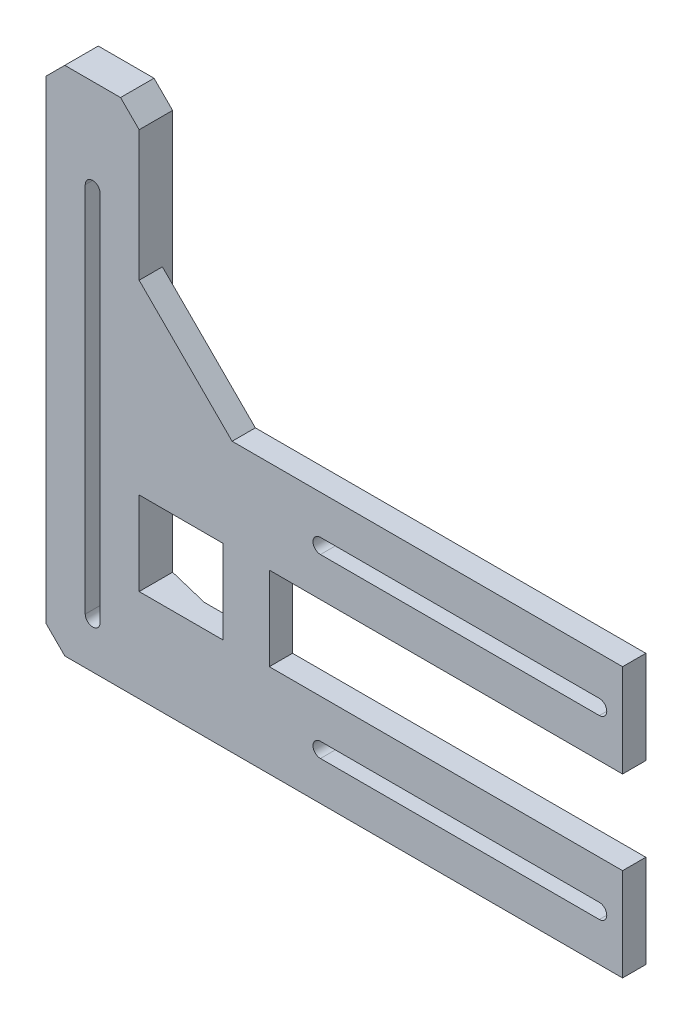
from build123d import *

# Parameters (mm, degrees)
SKETCH_1_W                  = 76
SKETCH_1_H                  = 20
SKETCH_1_W_2                = 18
SKETCH_1_W_3                = 10
SKETCH_1_H_2                = 18
SKETCH_1_W_4                = 20
SKETCH_1_H_3                = 52.041621827
EXTRUDE_1_DEPTH             = 5
HOLE_WIZARD_3_2_3_2_1_DEPTH = 5
SKETCH_8_W                  = 20
SKETCH_8_H                  = 110.041621827
EXTRUDE_2_DEPTH             = 2.2
HOLE_START                  = -2.2
HOLE_WIZARD_3_2_3_2_3_DEPTH = 7.2
RIB_1_REACH                 = 147.55
SKETCH_11_WALL_W            = 302.364540162
SKETCH_11_WALL_H            = 20
RIB_2_REACH                 = 113.533
SKETCH_12_WALL_W            = 234.330707354
SKETCH_12_WALL_H            = 20
RIB_3_REACH                 = 122.99
SKETCH_13_WALL_W            = 272.265137078
SKETCH_13_WALL_H            = 5
CHAMFER_1_SIZE              = 4


# Read off the part's stored shape, not the designer's step: Ø3.2 (3.2) 直径槽口1, Ø3.2 (3.2) 直径槽口3
with BuildPart() as part:
    # 草图1 → 凸台-拉伸1 (new body)
    with BuildSketch(Plane.XY):
        with Locations((-9.134530028, -25.635533007)):
            Rectangle(SKETCH_1_W, SKETCH_1_H)
        with Locations((-66.134530028, -25.635533007)):
            Rectangle(SKETCH_1_W_2, SKETCH_1_H)
        with Locations((-52.134530028, -25.635533007)):
            Rectangle(SKETCH_1_W_3, SKETCH_1_H)
        with Locations((-66.134530028, 12.364466993)):
            Rectangle(SKETCH_1_W_2, SKETCH_1_H)
        with Locations((-9.134530028, 12.364466993)):
            Rectangle(SKETCH_1_W, SKETCH_1_H)
        with Locations((-52.134530028, 12.364466993)):
            Rectangle(SKETCH_1_W_3, SKETCH_1_H)
        with Locations((-52.134530028, -6.635533007)):
            Rectangle(SKETCH_1_W_3, SKETCH_1_H_2)
        with Locations((-85.134530028, 12.364466993)):
            Rectangle(SKETCH_1_W_4, SKETCH_1_H)
        with Locations((-85.134530028, -6.635533007)):
            Rectangle(SKETCH_1_W_4, SKETCH_1_H_2)
        with Locations((-85.134530028, -25.635533007)):
            Rectangle(SKETCH_1_W_4, SKETCH_1_H)
        with Locations((-85.134530028, 48.385277907)):
            Rectangle(SKETCH_1_W_4, SKETCH_1_H_3)
    extrude(amount=EXTRUDE_1_DEPTH)

    # Ø3.2 (3.2) 直径槽口1 outline → Ø3.2 (3.2) 直径槽口1 (cut)
    with BuildSketch(Plane.XY):
        with BuildLine():
            Line((-36.134530028, 10.764466993), (23.865469972, 10.764466993))
            ThreePointArc((23.865469972, 10.764466993), (25.465469972, 12.364466993), (23.865469972, 13.964466993))
            Line((23.865469972, 13.964466993), (-36.134530028, 13.964466993))
            ThreePointArc((-36.134530028, 13.964466993), (-37.734530028, 12.364466993), (-36.134530028, 10.764466993))
        make_face()
        with BuildLine():
            Line((-36.134530028, -27.235533007), (23.865469972, -27.235533007))
            ThreePointArc((23.865469972, -27.235533007), (25.465469972, -25.635533007), (23.865469972, -24.035533007))
            Line((23.865469972, -24.035533007), (-36.134530028, -24.035533007))
            ThreePointArc((-36.134530028, -24.035533007), (-37.734530028, -25.635533007), (-36.134530028, -27.235533007))
        make_face()
    extrude(amount=HOLE_WIZARD_3_2_3_2_1_DEPTH, mode=Mode.SUBTRACT)

    # 草图8 → 凸台-拉伸2 (add)
    with BuildSketch(Plane(origin=(0, 0, 0), x_dir=(-1, 0, 0), z_dir=(0, 0, -1))):
        with Locations((85.134530028, 19.385277907)):
            Rectangle(SKETCH_8_W, SKETCH_8_H)
    extrude(amount=EXTRUDE_2_DEPTH)

    # Ø3.2 (3.2) 直径槽口3 outline → Ø3.2 (3.2) 直径槽口3 (cut)
    with BuildSketch(Plane.XY.offset(HOLE_START)):
        with BuildLine():
            Line((-83.534530028, -25.635533007), (-83.534530028, 54.364466993))
            ThreePointArc((-83.534530028, 54.364466993), (-85.134530028, 55.964466993), (-86.734530028, 54.364466993))
            Line((-86.734530028, 54.364466993), (-86.734530028, -25.635533007))
            ThreePointArc((-86.734530028, -25.635533007), (-85.134530028, -27.235533007), (-83.534530028, -25.635533007))
        make_face()
    extrude(amount=HOLE_WIZARD_3_2_3_2_3_DEPTH, mode=Mode.SUBTRACT)

    # 草图11 wall → 筋1 (add, up to next)
    with BuildSketch(Plane(origin=(-70.634530028, -35.635533007, -1.1), x_dir=(0.971399006497, 0, 0.237453090477), z_dir=(-0.237453090477, 0, 0.971399006497)), mode=Mode.PRIVATE) as rib_1_sk1:
        with Locations((0, 10)):
            Rectangle(SKETCH_11_WALL_W, SKETCH_11_WALL_H)
    rib_1_tool1 = extrude(rib_1_sk1.sketch, amount=RIB_1_REACH, mode=Mode.PRIVATE) - part.part
    add(rib_1_tool1.solids().sort_by_distance((-70.634530028, -35.635533007, -1.1))[0])

    # 草图12 wall → 筋2 (add, up to next)
    with BuildSketch(Plane(origin=(-70.634530028, 22.364466993, -1.1), x_dir=(0.971399006497, 0, 0.237453090477), z_dir=(0.237453090477, 0, -0.971399006497)), mode=Mode.PRIVATE) as rib_2_sk1:
        with Locations((0, 10)):
            Rectangle(SKETCH_12_WALL_W, SKETCH_12_WALL_H)
    rib_2_tool1 = extrude(rib_2_sk1.sketch, amount=-RIB_2_REACH, mode=Mode.PRIVATE) - part.part
    add(rib_2_tool1.solids().sort_by_distance((-70.634530028, 22.364466993, -1.1))[0])

    # 草图13 wall → 筋3 (add, up to next)
    with BuildSketch(Plane(origin=(-65.134530028, 32.364466993, 5), x_dir=(0.707106781187, -0.707106781187, 0), z_dir=(0.707106781187, 0.707106781187, 0)), mode=Mode.PRIVATE) as rib_3_sk1:
        with Locations((0, 2.5)):
            Rectangle(SKETCH_13_WALL_W, SKETCH_13_WALL_H)
    rib_3_tool1 = extrude(rib_3_sk1.sketch, amount=-RIB_3_REACH, mode=Mode.PRIVATE) - part.part
    add(rib_3_tool1.solids().sort_by_distance((-65.134530028, 32.364466993, 5))[0])

    # 倒角1
    chamfer_1_edges = [part.edges().sort_by_distance(p)[0] for p in [
        (-75.134530028, 74.40608882, 1.4),
        (-95.134530028, -35.635533007, 1.4),
        (-95.134530028, 74.40608882, 1.4),
    ]]
    chamfer(chamfer_1_edges, length=CHAMFER_1_SIZE)


solid = part.part
